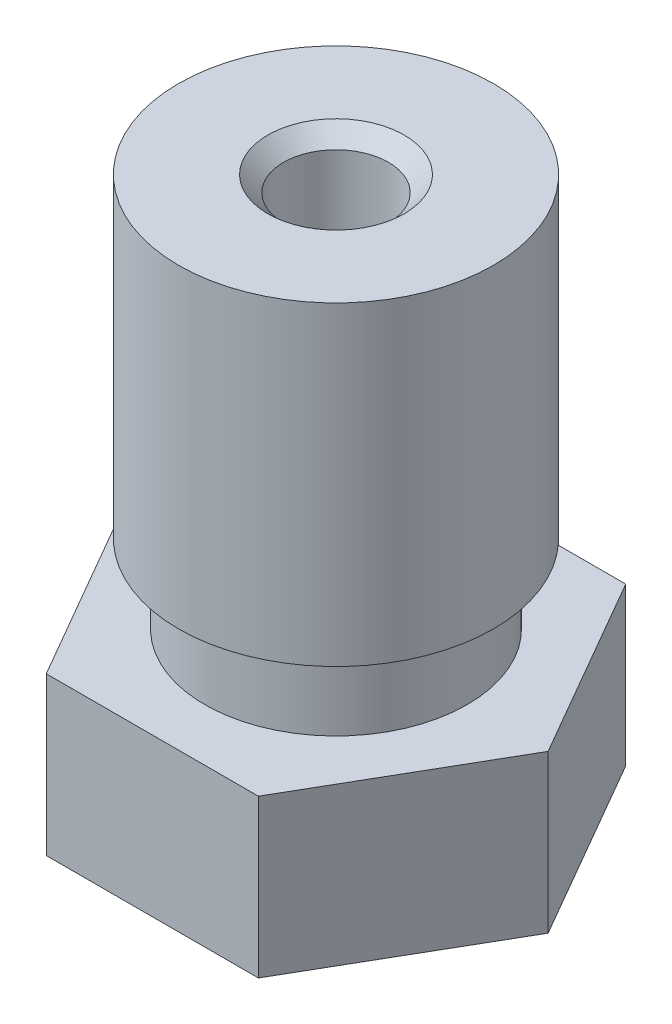
from build123d import *

# Parameters (mm, degrees)
BOSS_EXTRUDE1_START = -3
BOSS_EXTRUDE1_DEPTH = 3


with BuildPart() as part:
    # Sketch1 → Revolve1 (revolve)
    with BuildSketch(Plane.XY):
        Polygon((0, 0), (0.5, 0), (1.900415076, 2), (3.5, 2), (3.5, 5), (2.5, 5), (2.5, 6.5), (3, 6.5), (3, 12.5), (0, 12.5), align=None)
    revolve(axis=Axis((0, -1.1291331, 0), (0, -1, 0)))

    # Sketch2 → Cut-Revolve1 (revolve, cut)
    with BuildSketch(Plane.XY):
        Polygon((0, 12.5), (1.3, 12.5), (1, 12.2), (1, 1.985640646), (0.2, 0.6), (0.2, 0), (0, 0), align=None)
    revolve(axis=Axis((0, 0, 0), (0, 1, 0)), mode=Mode.SUBTRACT)

    # Sketch3 → Boss-Extrude1 (add)
    with BuildSketch(Plane.XZ.offset(-2).offset(BOSS_EXTRUDE1_START)):
        with BuildLine():
            Line((3.031088921, -1.749999986), (4.041451884, 0))
            Line((4.041451884, 0), (3.031088921, 1.749999986))
            ThreePointArc((3.031088921, 1.749999986), (3.5, 0), (3.031088921, -1.749999986))
        make_face()
        with BuildLine():
            ThreePointArc((0, 3.5), (1.750000007, 3.031088909), (3.031088921, 1.749999986))
            Line((3.031088921, 1.749999986), (2.020725942, 3.5))
            Line((2.020725942, 3.5), (0, 3.5))
        make_face()
        with BuildLine():
            Line((2.020725942, -3.5), (3.031088921, -1.749999986))
            ThreePointArc((3.031088921, -1.749999986), (1.750000007, -3.031088909), (0, -3.5))
            Line((0, -3.5), (2.020725942, -3.5))
        make_face()
        with BuildLine():
            ThreePointArc((-3.03108888, 1.750000057), (-1.749999971, 3.03108893), (0, 3.5))
            Line((0, 3.5), (-2.020725942, 3.5))
            Line((-2.020725942, 3.5), (-3.03108888, 1.750000057))
        make_face()
        with BuildLine():
            Line((-2.020725942, -3.5), (0, -3.5))
            ThreePointArc((0, -3.5), (-1.750000043, -3.031088888), (-3.031088963, -1.749999914))
            Line((-3.031088963, -1.749999914), (-2.020725942, -3.5))
        make_face()
        with BuildLine():
            ThreePointArc((-3.031088963, -1.749999914), (-3.5, 8.3e-08), (-3.03108888, 1.750000057))
            Line((-3.03108888, 1.750000057), (-4.041451884, 0))
            Line((-4.041451884, 0), (-3.031088963, -1.749999914))
        make_face()
    extrude(amount=BOSS_EXTRUDE1_DEPTH)


solid = part.part
